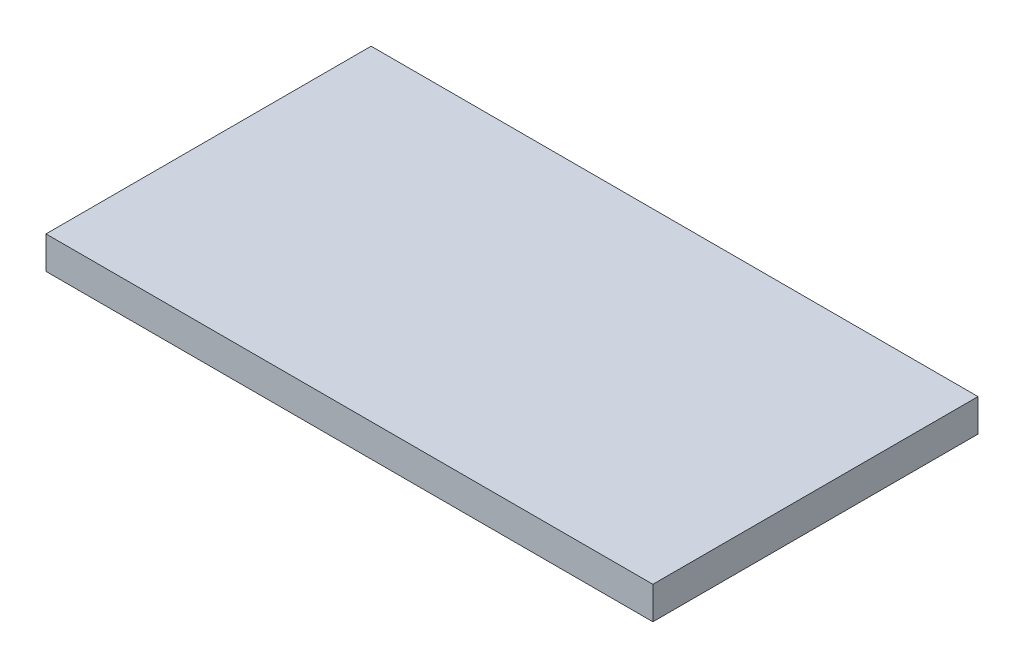
from build123d import *

# Parameters (mm, degrees)
SKETCH1_W           = 1422.4
SKETCH1_H           = 762
BOSS_EXTRUDE1_DEPTH = 76.2


with BuildPart() as part:
    # Sketch1 → Boss-Extrude1 (new body)
    with BuildSketch(Plane(origin=(0, 0, 0), x_dir=(1, 0, 0), z_dir=(0, 1, 0))):
        with Locations((711.2, 381)):
            Rectangle(SKETCH1_W, SKETCH1_H)
    extrude(amount=BOSS_EXTRUDE1_DEPTH)


solid = part.part
